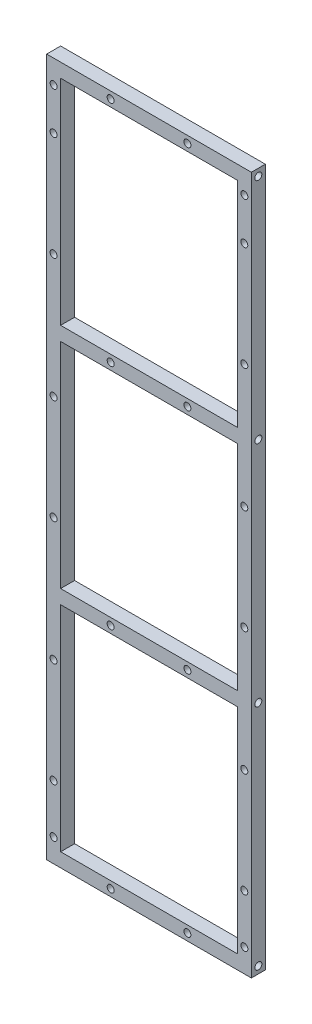
from build123d import *

# Parameters (mm, degrees)
SKETCH1_W           = 88
SKETCH1_H           = 300
SKETCH1_W_2         = 76
SKETCH1_H_2         = 92
BOSS_EXTRUDE1_DEPTH = 6
SKETCH2_R           = 1.5
CUT_EXTRUDE1_DEPTH  = 10
SKETCH3_R           = 1.5
CUT_EXTRUDE2_DEPTH  = 10
SKETCH4_R           = 1.5
CUT_EXTRUDE3_DEPTH  = 10


with BuildPart() as part:
    # Sketch1 → Boss-Extrude1 (new body)
    with BuildSketch(Plane.XY):
        Rectangle(SKETCH1_W, SKETCH1_H)
        with Locations((0, 98)):
            Rectangle(SKETCH1_W_2, SKETCH1_H_2, mode=Mode.SUBTRACT)
        with Locations((0, -98)):
            Rectangle(SKETCH1_W_2, SKETCH1_H_2, mode=Mode.SUBTRACT)
        Rectangle(SKETCH1_W_2, SKETCH1_H_2, mode=Mode.SUBTRACT)
    extrude(amount=BOSS_EXTRUDE1_DEPTH)

    # Sketch2 → Cut-Extrude1 (cut)
    with BuildSketch(Plane(origin=(44, 0, 0), x_dir=(0, 0, -1), z_dir=(1, 0, 0))):
        with Locations((-3, 147)):
            Circle(SKETCH2_R)
        with Locations((-3, 49)):
            Circle(SKETCH2_R)
        with Locations((-3, -49)):
            Circle(SKETCH2_R)
        with Locations((-3, -147)):
            Circle(SKETCH2_R)
    cut_extrude1 = extrude(amount=-CUT_EXTRUDE1_DEPTH, mode=Mode.SUBTRACT)

    # Mirror1: Cut-Extrude1 across plane
    add(cut_extrude1.mirror(Plane(origin=(0, 0, 0), x_dir=(0, 0, 1), z_dir=(1, 0, 0))), mode=Mode.SUBTRACT)

    # Sketch3 → Cut-Extrude2 (cut)
    with BuildSketch(Plane.XY.offset(6)):
        with Locations((-41, 140)):
            Circle(SKETCH3_R)
        with Locations((41, 140)):
            Circle(SKETCH3_R)
        with Locations((41, -140)):
            Circle(SKETCH3_R)
        with Locations((-41, -140)):
            Circle(SKETCH3_R)
    extrude(amount=-CUT_EXTRUDE2_DEPTH, mode=Mode.SUBTRACT)

    # Sketch4 → Cut-Extrude3 (cut)
    with BuildSketch(Plane.XY.offset(6)):
        with Locations((-16.5, 147)):
            Circle(SKETCH4_R)
        with Locations((16.5, 147)):
            Circle(SKETCH4_R)
        with Locations((16.5, 49)):
            Circle(SKETCH4_R)
        with Locations((-16.5, 49)):
            Circle(SKETCH4_R)
        with Locations((16.5, -49)):
            Circle(SKETCH4_R)
        with Locations((-16.5, -49)):
            Circle(SKETCH4_R)
        with Locations((16.5, -147)):
            Circle(SKETCH4_R)
        with Locations((-16.5, -147)):
            Circle(SKETCH4_R)
        with Locations((-41.040928423, 122)):
            Circle(SKETCH4_R)
        with Locations((-41.040928423, 77)):
            Circle(SKETCH4_R)
        with Locations((40.959071577, 122)):
            Circle(SKETCH4_R)
        with Locations((40.959071577, 77)):
            Circle(SKETCH4_R)
        with Locations((40.959071577, 24)):
            Circle(SKETCH4_R)
        with Locations((40.959071577, -21)):
            Circle(SKETCH4_R)
        with Locations((40.959071577, -74)):
            Circle(SKETCH4_R)
        with Locations((40.959071577, -119)):
            Circle(SKETCH4_R)
        with Locations((-41.040928423, 24)):
            Circle(SKETCH4_R)
        with Locations((-41.040928423, -21)):
            Circle(SKETCH4_R)
        with Locations((-41.040928423, -74)):
            Circle(SKETCH4_R)
        with Locations((-41.040928423, -119)):
            Circle(SKETCH4_R)
    extrude(amount=-CUT_EXTRUDE3_DEPTH, mode=Mode.SUBTRACT)


solid = part.part
